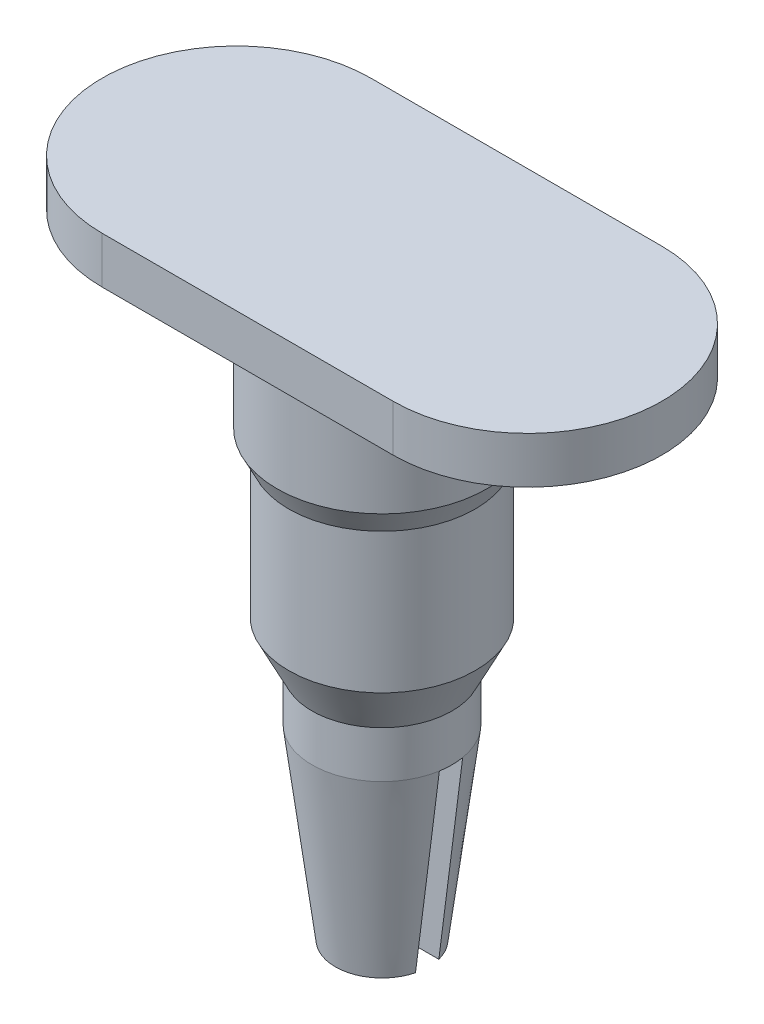
from build123d import *

# Parameters (mm, degrees)
BOSS_EXTRUDE1_DEPTH     = 0.1
SKETCH2_R               = 0.225
BOSS_EXTRUDE2_DEPTH     = 0.3
SKETCH3_R               = 0.2
BOSS_EXTRUDE3_DEPTH     = 0.4
SKETCH4_R               = 0.15
BOSS_EXTRUDE4_DEPTH     = 0.1
SKETCH5_R               = 0.15
BOSS_EXTRUDE5_DEPTH     = 0.4
CHAMFER1_SIZE           = 0.05
CHAMFER1_SIZE_2         = 0.025
CHAMFER2_SIZE           = 0.1
CHAMFER2_SIZE_2         = 0.05
CHAMFER3_SIZE           = 0.4
CHAMFER3_SIZE2          = 0.05
CUT_EXTRUDE1_DEPTH      = 2.372204066
CUT_EXTRUDE1_DEPTH_BACK = 2.372204066
SKETCH6_W               = 0.05
SKETCH6_H               = 0.517449495


with BuildPart() as part:
    # Sketch1 → Boss-Extrude1 (new body)
    with BuildSketch(Plane(origin=(0, 0, 0), x_dir=(1, 0, 0), z_dir=(0, 1, 0))):
        with BuildLine():
            Line((-0.312, 0.288), (0.312, 0.288))
            ThreePointArc((0.312, 0.288), (0.6, 0), (0.312, -0.288))
            Line((0.312, -0.288), (-0.312, -0.288))
            ThreePointArc((-0.312, -0.288), (-0.6, 0), (-0.312, 0.288))
        make_face()
    extrude(amount=BOSS_EXTRUDE1_DEPTH)

    # Sketch2 → Boss-Extrude2 (add)
    with BuildSketch(Plane(origin=(0, 0, 0), x_dir=(1, 0, 0), z_dir=(0, 1, 0))):
        with Locations(Location((0, 0, 0), (0, 0, 270))):
            Circle(SKETCH2_R)
    extrude(amount=-BOSS_EXTRUDE2_DEPTH)

    # Sketch3 → Boss-Extrude3 (add)
    with BuildSketch(Plane.XZ.offset(0.3)):
        with Locations(Location((0, 0, 0), (0, 0, 90))):
            Circle(SKETCH3_R)
    extrude(amount=BOSS_EXTRUDE3_DEPTH)

    # Sketch4 → Boss-Extrude4 (add)
    with BuildSketch(Plane.XZ.offset(0.7)):
        with Locations(Location((0, 0, 0), (0, 0, 270))):
            Circle(SKETCH4_R)
    extrude(amount=BOSS_EXTRUDE4_DEPTH)

    # Sketch5 → Boss-Extrude5 (add)
    with BuildSketch(Plane.XZ.offset(0.8)):
        with Locations(Location((0, 0, 0), (0, 0, 270))):
            Circle(SKETCH5_R)
    extrude(amount=BOSS_EXTRUDE5_DEPTH)

    # Chamfer1
    # the kernel refuses this chamfer: 0.05, 0.025 mm, written as the material it takes off along each edge
    with BuildSketch(Plane(origin=(0, -0.3, 0), x_dir=(0, 0, 1), z_dir=(-1, 0, 0))) as chamfer1_piece_1_section:
        Polygon((0.225, CHAMFER1_SIZE), (0.225 - CHAMFER1_SIZE_2, 0), (0.225, 0), align=None)
    chamfer1_piece_1 = revolve(axis=Axis((0, -0.3, 0), (0, 1, 0)), mode=Mode.PRIVATE)
    chamfer1_piece_1 = chamfer1_piece_1 - Plane(origin=(0, -0.274549164, 0), x_dir=(0, 0, 1), z_dir=(0, 1, 0)) * Cylinder(0.2, 1, mode=Mode.PRIVATE)
    add(chamfer1_piece_1, mode=Mode.SUBTRACT)

    # Chamfer2
    # the kernel refuses this chamfer: 0.1, 0.05 mm, written as the material it takes off along each edge
    with BuildSketch(Plane(origin=(0, -0.7, 0), x_dir=(0, 0, 1), z_dir=(1, 0, 0))) as chamfer2_piece_1_section:
        Polygon((0.2, -CHAMFER2_SIZE), (0.2 - CHAMFER2_SIZE_2, 0), (0.2, 0), align=None)
    chamfer2_piece_1 = revolve(axis=Axis((0, -0.7, 0), (0, -1, 0)), mode=Mode.PRIVATE)
    chamfer2_piece_1 = chamfer2_piece_1 - Plane(origin=(0, -0.64887778, 0), x_dir=(0, 0, -1), z_dir=(0, 1, 0)) * Cylinder(0.15, 1, mode=Mode.PRIVATE)
    add(chamfer2_piece_1, mode=Mode.SUBTRACT)

    # Chamfer3
    chamfer3_edges = [part.edges().sort_by_distance(p)[0] for p in [
        (0, -1.2, 0.15),
    ]]
    chamfer3_side = [part.faces().sort_by_distance(p)[0] for p in [
        (0, -0.95, 0.15),
    ]]
    chamfer(chamfer3_edges, length=CHAMFER3_SIZE, length2=CHAMFER3_SIZE2, reference=chamfer3_side[0])

    # Sketch6 → Cut-Extrude1 (cut, two sides: drawn at the far end of the back side and taken through both)
    with BuildSketch(Plane(origin=(0, 0, 0), x_dir=(0, 0, -1), z_dir=(1, 0, 0)).offset(-CUT_EXTRUDE1_DEPTH_BACK)):
        with Locations((0, -1.058724748)):
            Rectangle(SKETCH6_W, SKETCH6_H)
    extrude(amount=CUT_EXTRUDE1_DEPTH + CUT_EXTRUDE1_DEPTH_BACK, mode=Mode.SUBTRACT)


solid = part.part
